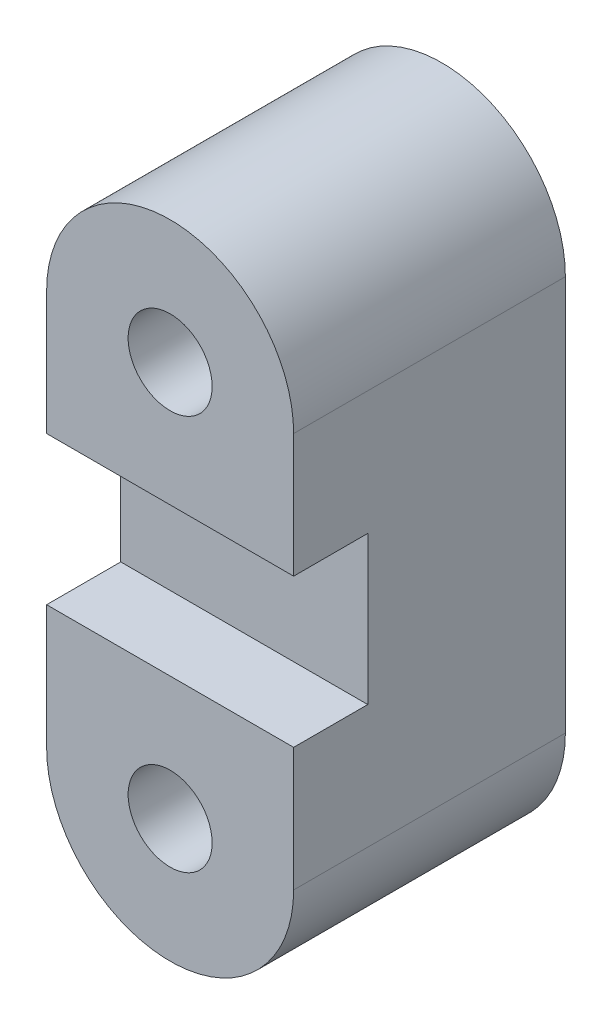
from build123d import *

# Parameters (mm, degrees)
SKETCH1_R           = 1.7
BOSS_EXTRUDE1_DEPTH = 11
SKETCH2_W           = 10
SKETCH2_H           = 6
CUT_EXTRUDE1_DEPTH  = 3


with BuildPart() as part:
    # Sketch1 → Boss-Extrude1 (new body)
    with BuildSketch(Plane.XY):
        with BuildLine():
            Line((-5, -8), (-5, 8))
            ThreePointArc((-5, 8), (0, 13), (5, 8))
            Line((5, 8), (5, -8))
            ThreePointArc((5, -8), (0, -13), (-5, -8))
        make_face()
        with Locations((0, 8)):
            Circle(SKETCH1_R, mode=Mode.SUBTRACT)
        with Locations((0, -8)):
            Circle(SKETCH1_R, mode=Mode.SUBTRACT)
    extrude(amount=BOSS_EXTRUDE1_DEPTH)

    # Sketch2 → Cut-Extrude1 (cut)
    with BuildSketch(Plane.XY.offset(11)):
        Rectangle(SKETCH2_W, SKETCH2_H)
    extrude(amount=-CUT_EXTRUDE1_DEPTH, mode=Mode.SUBTRACT)


solid = part.part
